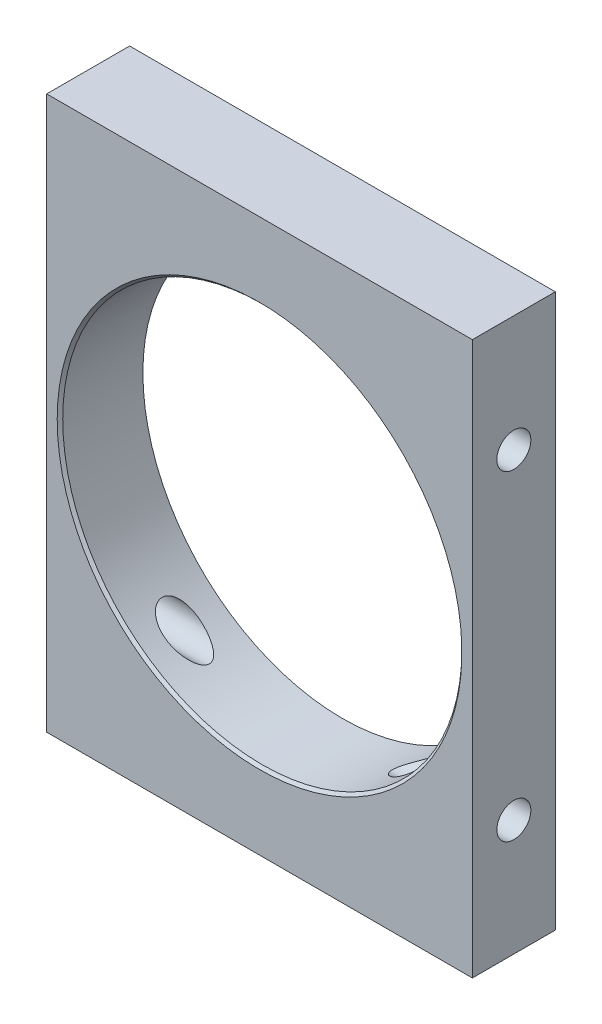
from build123d import *

# Parameters (mm, degrees)
SKIZZE1_W                       = 77
SKIZZE1_H                       = 100
AUFSATZ_LINEAR_AUSTRAGEN1_DEPTH = 7.5
SKIZZE2_R                       = 36.1
SCHNITT_LINEAR_AUSTRAGEN1_DEPTH = 65.863317831
SKIZZE3_R                       = 3.075
SCHNITT_LINEAR_AUSTRAGEN2_DEPTH = 93.115416734
FASE1_SIZE                      = 0.5


with BuildPart() as part:
    # Skizze1 → Aufsatz-Linear austragen1 (new, symmetric)
    with BuildSketch(Plane.XY):
        Rectangle(SKIZZE1_W, SKIZZE1_H)
    extrude(amount=AUFSATZ_LINEAR_AUSTRAGEN1_DEPTH, both=True)

    # Skizze2 → Schnitt-Linear austragen1 (cut, through all)
    with BuildSketch(Plane.XY.offset(7.5)):
        Circle(SKIZZE2_R)
    extrude(amount=-SCHNITT_LINEAR_AUSTRAGEN1_DEPTH, mode=Mode.SUBTRACT)

    # Skizze3 → Schnitt-Linear austragen2 (cut, through all)
    with BuildSketch(Plane(origin=(38.5, 0, 0), x_dir=(0, 0, -1), z_dir=(1, 0, 0))):
        with Locations((0, 29)):
            Circle(SKIZZE3_R)
        with Locations((0, -29)):
            Circle(SKIZZE3_R)
    extrude(amount=-SCHNITT_LINEAR_AUSTRAGEN2_DEPTH, mode=Mode.SUBTRACT)

    # Fase1
    fase1_edges = [part.edges().sort_by_distance(p)[0] for p in [
        (-36.1, 0, 7.5),
    ]]
    chamfer(fase1_edges, length=FASE1_SIZE)


solid = part.part
